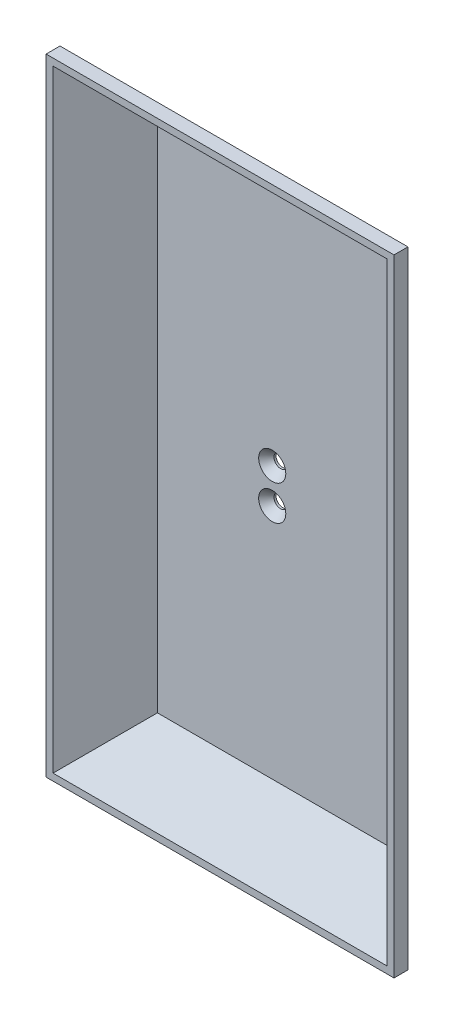
from build123d import *

# Parameters (mm, degrees)
SKETCH_1_W               = 100
SKETCH_1_H               = 180
EXTRUDE_1_DEPTH          = 4
SKETCH_4_W               = 100
SKETCH_4_H               = 180
SKETCH_4_W_2             = 96
SKETCH_4_H_2             = 176
EXTRUDE_3_DEPTH          = 15
CHAMFER_1_SIZE           = 15
CUT_EXTRUDE_3_DEPTH      = 10
CUT_EXTRUDE_3_DEPTH_BACK = 105.694794522
SKETCH_6_R               = 1.9
CHAMFER_2_SIZE           = 2
CHAMFER_2_SIZE2          = 2.4
SKETCH_10_W              = 12.2
SKETCH_10_H              = 22.3
CUT_EXTRUDE_4_DEPTH      = 1


with BuildPart() as part:
    # 스케치1 → 보스-돌출1 (new body)
    with BuildSketch(Plane.XY):
        Rectangle(SKETCH_1_W, SKETCH_1_H)
    extrude(amount=EXTRUDE_1_DEPTH)

    # 스케치4 → 보스-돌출3 (add)
    with BuildSketch(Plane.XY.offset(4)):
        Rectangle(SKETCH_4_W, SKETCH_4_H)
        Rectangle(SKETCH_4_W_2, SKETCH_4_H_2, mode=Mode.SUBTRACT)
    extrude(amount=EXTRUDE_3_DEPTH)

    # 모따기1
    chamfer_1_edges = [part.edges().sort_by_distance(p)[0] for p in [
        (-48, 0, 4),
        (0, -88, 4),
        (50, 0, 0),
        (0, 90, 0),
        (-50, 0, 0),
        (0, -90, 0),
        (48, 0, 4),
        (0, 88, 4),
    ]]
    chamfer(chamfer_1_edges, length=CHAMFER_1_SIZE - 0.0001)  # a hair under: the kernel refuses the full size

    # 스케치6 → 컷-돌출3 (cut, two sides: drawn at the far end of the back side and taken through both)
    with BuildSketch(Plane.XY.offset(-CUT_EXTRUDE_3_DEPTH_BACK)):
        with Locations((0, 5)):
            Circle(SKETCH_6_R)
        with Locations((0, -5)):
            Circle(SKETCH_6_R)
    extrude(amount=CUT_EXTRUDE_3_DEPTH + CUT_EXTRUDE_3_DEPTH_BACK, mode=Mode.SUBTRACT)

    # 모따기2
    chamfer_2_edges = [part.edges().sort_by_distance(p)[0] for p in [
        (-1.9, 5, 4),
        (-1.9, -5, 4),
    ]]
    chamfer_2_side = [part.faces().sort_by_distance(p)[0] for p in [
        (0, 0, 4),
    ]]
    chamfer(chamfer_2_edges, length=CHAMFER_2_SIZE, length2=CHAMFER_2_SIZE2, reference=chamfer_2_side[0])

    # 스케치10 → 컷-돌출4 (cut)
    with BuildSketch(Plane(origin=(0, 0, 0), x_dir=(-1, 0, 0), z_dir=(0, 0, -1))):
        Rectangle(SKETCH_10_W, SKETCH_10_H)
    extrude(amount=-CUT_EXTRUDE_4_DEPTH, mode=Mode.SUBTRACT)


solid = part.part
